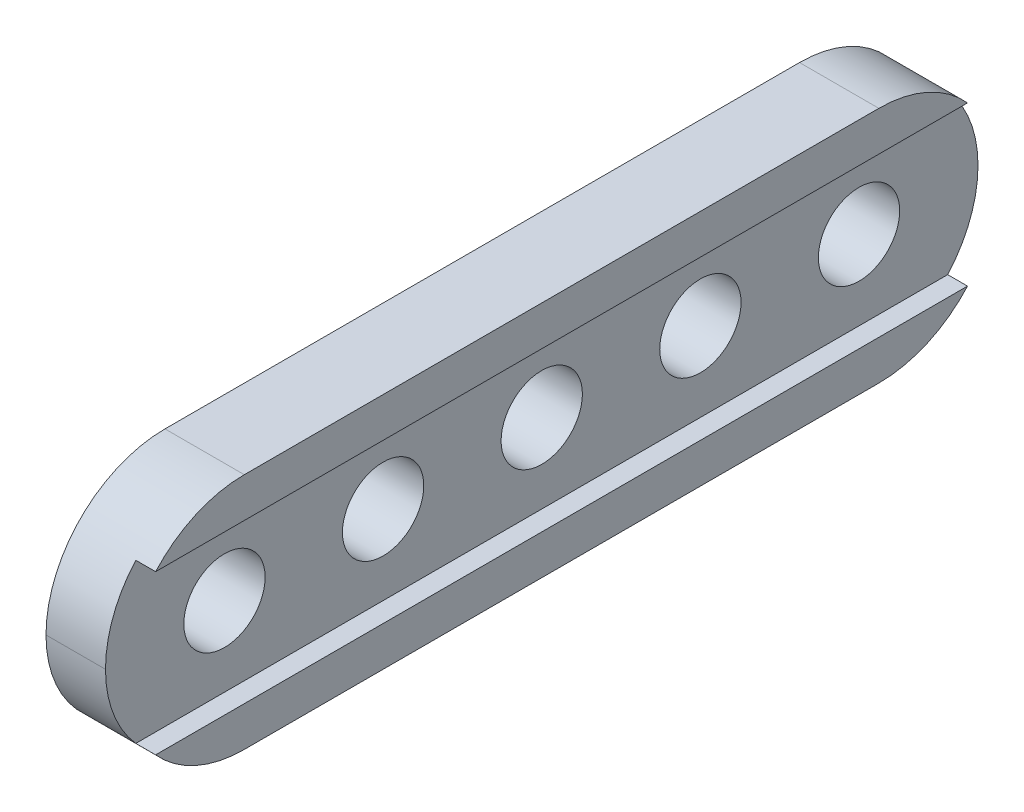
from build123d import *

# Parameters (mm, degrees)
BOSS_EXTRUDE1_DEPTH     = 44
FILLET1_R               = 6
SKETCH2_R               = 2.05
CUT_EXTRUDE1_DEPTH      = 46.782092569
LPATTERN1_COUNT         = 3
LPATTERN1_PITCH         = 8
MIRROR1_COPY_1_SKETCH_R = 2.05
MIRROR1_COPY_1_DEPTH    = 46.782092569
MIRROR1_COPY_2_SKETCH_R = 2.05
MIRROR1_COPY_2_DEPTH    = 46.782092569


with BuildPart() as part:
    # Sketch1 → Boss-Extrude1 (new body)
    with BuildSketch(Plane.XY):
        Polygon((0, 0), (4, 0), (4, 2), (3, 2), (3, 10), (4, 10), (4, 12), (0, 12), align=None)
    extrude(amount=-BOSS_EXTRUDE1_DEPTH)

    # Fillet1
    fillet1_edges = [part.edges().sort_by_distance(p)[0] for p in [
        (2, 12, 0),
        (2, 0, 0),
        (2, 0, -44),
        (2, 12, -44),
    ]]
    fillet(fillet1_edges, radius=FILLET1_R - 0.0001)  # a hair under: the kernel refuses the full size

    # Sketch2 → Cut-Extrude1 (cut, through all)
    with BuildSketch(Plane.ZY):
        with Locations(Location((-38, 6, 0), (0, 0, 270))):
            Circle(SKETCH2_R)
    cut_extrude1 = extrude(amount=-CUT_EXTRUDE1_DEPTH, mode=Mode.SUBTRACT)

    # LPattern1: Cut-Extrude1 ×3
    with Locations(*[(0, 0, i * LPATTERN1_PITCH) for i in range(1, LPATTERN1_COUNT)]):
        add(cut_extrude1, mode=Mode.SUBTRACT)

    # Mirror1: Cut-Extrude1 across plane
    add(cut_extrude1.mirror(Plane.XY.offset(-22)), mode=Mode.SUBTRACT)

    # Mirror1 copy 1 sketch → Mirror1 copy 1 (cut, through all)
    with BuildSketch(Plane(origin=(0, 0, -52), x_dir=(0, 0, -1), z_dir=(-1, 0, 0))):
        with Locations((-38, -6)):
            Circle(MIRROR1_COPY_1_SKETCH_R)
    extrude(amount=-MIRROR1_COPY_1_DEPTH, mode=Mode.SUBTRACT)

    # Mirror1 copy 2 sketch → Mirror1 copy 2 (cut, through all)
    with BuildSketch(Plane(origin=(0, 0, -60), x_dir=(0, 0, -1), z_dir=(-1, 0, 0))):
        with Locations((-38, -6)):
            Circle(MIRROR1_COPY_2_SKETCH_R)
    extrude(amount=-MIRROR1_COPY_2_DEPTH, mode=Mode.SUBTRACT)


solid = part.part
